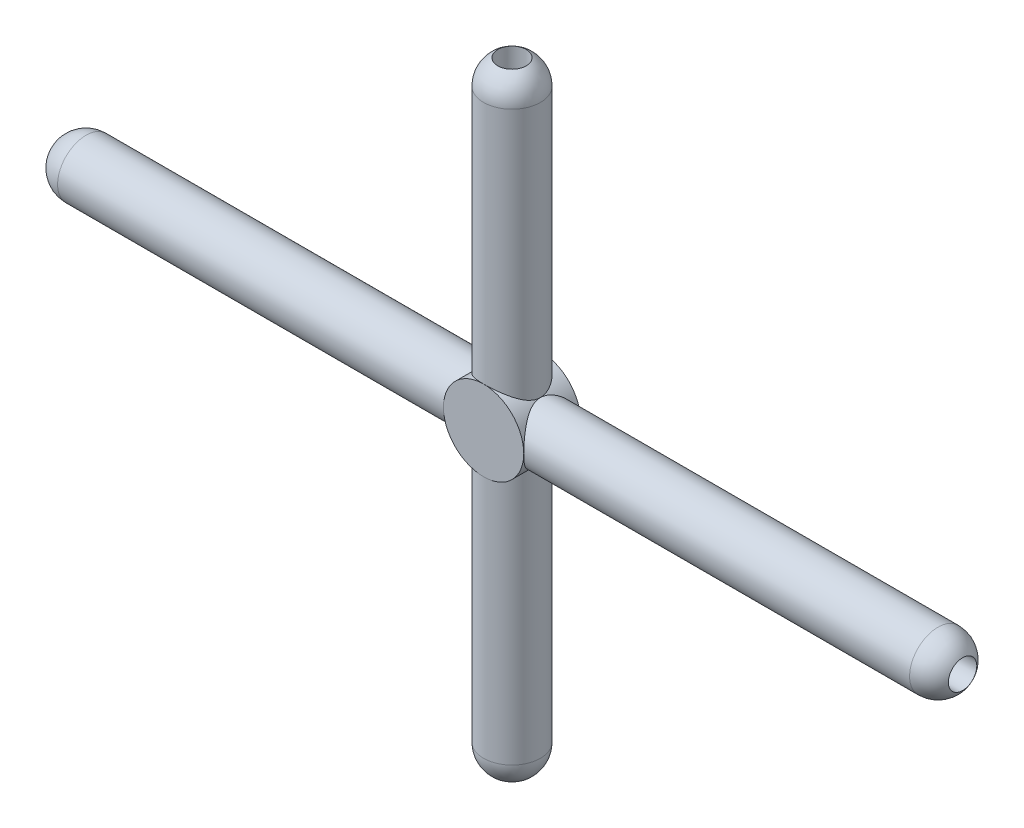
from build123d import *
from build123d.topology import SkipClean

# Parameters (mm, degrees)
SKETCH_5_R               = 70.710678119
EXTRUDE_1_DEPTH          = 50
SKETCH_6_R               = 25
CUT_EXTRUDE_1_DEPTH      = 842
PATTERN_CIRCULAR_1_COUNT = 4


with BuildPart() as part:
    # 草图2 → 旋转8 (revolve)
    with BuildSketch(Plane.XY):
        with BuildLine():
            Line((-750, -50), (750, -50))
            ThreePointArc((750, -50), (785.355339059, -35.355339059), (800, 0))
            Line((800, 0), (750, 0))
            Line((750, 0), (-750, 0))
            Line((-750, 0), (-800, 0))
            ThreePointArc((-800, 0), (-785.355339059, -35.355339059), (-750, -50))
        make_face()
    revolve(axis=Axis((-750, 0, 0), (1, 0, 0)))

    # 草图3 → 旋转9 (revolve)
    with BuildSketch(Plane.XY):
        with BuildLine():
            Line((0, 0), (0, 500))
            Line((0, 500), (0, 550))
            ThreePointArc((0, 550), (-35.355339059, 535.355339059), (-50, 500))
            Line((-50, 500), (-50, -500))
            ThreePointArc((-50, -500), (-35.355339059, -535.355339059), (0, -550))
            Line((0, -550), (0, -500))
            Line((0, -500), (0, 0))
        make_face()
    revolve(axis=Axis((0, 0, 0), (0, 1, 0)))

    # 草图5 → 凸台-拉伸1 (add, symmetric)
    with BuildSketch(Plane.XY):
        Circle(SKETCH_5_R)
    extrude(amount=EXTRUDE_1_DEPTH, both=True)

    # 草图6 → 切除-拉伸1 (cut)
    with BuildSketch(Plane(origin=(0, 0, 0), x_dir=(0, 0, -1), z_dir=(1, 0, 0))):
        with Locations(Location((0, 0, 0), (0, 0, 180))):
            Circle(SKETCH_6_R)
    cut_extrude_1 = extrude(amount=CUT_EXTRUDE_1_DEPTH, mode=Mode.SUBTRACT)

    # 阵列(圆周)1: 切除-拉伸1 ×4 about axis
    with SkipClean():  # the faces are left unmerged after this step: merging them gives an invalid solid
        pattern_circular_1_axis = Axis((0, 0, 0), (0, 0, 1))
        for i in range(1, PATTERN_CIRCULAR_1_COUNT):
            add(cut_extrude_1.rotate(pattern_circular_1_axis, i * 360 / PATTERN_CIRCULAR_1_COUNT), mode=Mode.SUBTRACT)
    add(part.part.scale(1), mode=Mode.REPLACE)  # the faces are merged on a copy


solid = part.part
